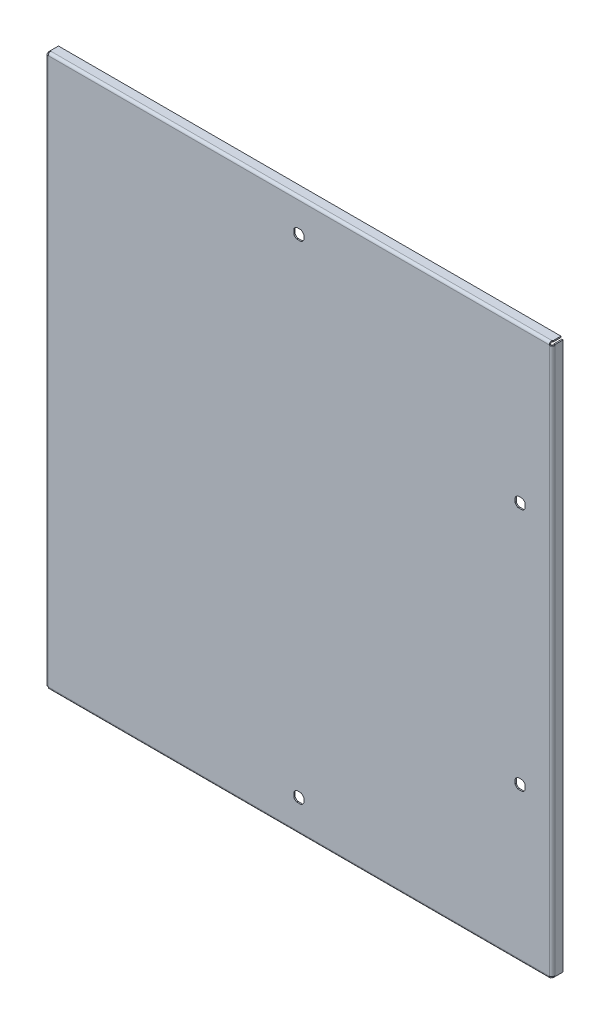
from build123d import *

# Parameters (mm, degrees)
SKETCH1_W               = 1003.3
SKETCH1_H               = 1092.2
SKETCH1_W_2             = 998.22
SKETCH1_H_2             = 1087.12
BOSS_EXTRUDE1_DEPTH     = 21.59
SKETCH3_W               = 1003.3
SKETCH3_H               = 1092.2
BOSS_EXTRUDE2_DEPTH     = 2.54
CUT_EXTRUDE1_REACH      = 865.963
CONVERT_SOLID1_START    = -495.3
CONVERT_SOLID1_DEPTH    = 1003.3
CONVERT_SOLID1_2_DEPTH  = 4.336051224
CONVERT_SOLID1_START_2  = 503.663948776
CONVERT_SOLID1_3_DEPTH  = 4.336051224
CONVERT_SOLID1_START_3  = -490.963948776
CONVERT_SOLID1_4_DEPTH  = 1.378948776
CONVERT_SOLID1_START_4  = 502.285
CONVERT_SOLID1_5_DEPTH  = 1.378948776
CONVERT_SOLID1_START_5  = -489.585
CONVERT_SOLID1_6_DEPTH  = 991.87
CONVERT_SOLID1_START_6  = -391.16
CONVERT_SOLID1_7_DEPTH  = 1087.12
CONVERT_SOLID1_8_DEPTH  = 1.796051224
CONVERT_SOLID1_START_7  = 694.163948776
CONVERT_SOLID1_9_DEPTH  = 1.796051224
CONVERT_SOLID1_START_8  = -389.363948776
CONVERT_SOLID1_10_DEPTH = 1.378948776
CONVERT_SOLID1_START_9  = 692.785
CONVERT_SOLID1_11_DEPTH = 1.378948776
CONVERT_SOLID1_START_10 = -387.985
CONVERT_SOLID1_12_DEPTH = 1080.77


with BuildPart() as part:
    # Sketch1 → Boss-Extrude1 (new body)
    with BuildSketch(Plane.XY):
        with Locations((6.35, 152.4)):
            Rectangle(SKETCH1_W, SKETCH1_H)
        with Locations((6.35, 152.4)):
            Rectangle(SKETCH1_W_2, SKETCH1_H_2, mode=Mode.SUBTRACT)
    extrude(amount=BOSS_EXTRUDE1_DEPTH)

    # Sketch3 → Boss-Extrude2 (add)
    with BuildSketch(Plane.XY.offset(21.59)):
        with Locations((6.35, 152.4)):
            Rectangle(SKETCH3_W, SKETCH3_H)
    extrude(amount=-BOSS_EXTRUDE2_DEPTH)

    # Sketch4 → Cut-Extrude1 (cut, up to next)
    with BuildSketch(Plane.XY.offset(21.59), mode=Mode.PRIVATE) as cut_extrude1_sk1:
        with BuildLine():
            Line((440.173338469, 403.65), (448.826661531, 403.65))
            ThreePointArc((448.826661531, 403.65), (452.172108576, 401.372108576), (454.45, 398.026661531))
            Line((454.45, 398.026661531), (454.45, 389.373338469))
            ThreePointArc((454.45, 389.373338469), (452.172108576, 386.027891424), (448.826661531, 383.75))
            Line((448.826661531, 383.75), (440.173338469, 383.75))
            ThreePointArc((440.173338469, 383.75), (436.827891424, 386.027891424), (434.55, 389.373338469))
            Line((434.55, 389.373338469), (434.55, 398.026661531))
            ThreePointArc((434.55, 398.026661531), (436.827891424, 401.372108576), (440.173338469, 403.65))
        make_face()
    cut_extrude1_tool1 = extrude(cut_extrude1_sk1.sketch, amount=-CUT_EXTRUDE1_REACH, mode=Mode.PRIVATE) & part.part
    # Sketch4 → Cut-Extrude1 (cut, up to next)
    with BuildSketch(Plane.XY.offset(21.59), mode=Mode.PRIVATE) as cut_extrude1_sk2:
        with BuildLine():
            Line((440.173338469, -78.95), (448.826661531, -78.95))
            ThreePointArc((448.826661531, -78.95), (452.172108576, -81.227891424), (454.45, -84.573338469))
            Line((454.45, -84.573338469), (454.45, -93.226661531))
            ThreePointArc((454.45, -93.226661531), (452.172108576, -96.572108576), (448.826661531, -98.85))
            Line((448.826661531, -98.85), (440.173338469, -98.85))
            ThreePointArc((440.173338469, -98.85), (436.827891424, -96.572108576), (434.55, -93.226661531))
            Line((434.55, -93.226661531), (434.55, -84.573338469))
            ThreePointArc((434.55, -84.573338469), (436.827891424, -81.227891424), (440.173338469, -78.95))
        make_face()
    cut_extrude1_tool2 = extrude(cut_extrude1_sk2.sketch, amount=-CUT_EXTRUDE1_REACH, mode=Mode.PRIVATE) & part.part
    # Sketch4 → Cut-Extrude1 (cut, up to next)
    with BuildSketch(Plane.XY.offset(21.59), mode=Mode.PRIVATE) as cut_extrude1_sk3:
        with BuildLine():
            Line((2.023338469, 644.95), (10.676661531, 644.95))
            ThreePointArc((10.676661531, 644.95), (14.022108576, 642.672108576), (16.3, 639.326661531))
            Line((16.3, 639.326661531), (16.3, 630.673338469))
            ThreePointArc((16.3, 630.673338469), (14.022108576, 627.327891424), (10.676661531, 625.05))
            Line((10.676661531, 625.05), (2.023338469, 625.05))
            ThreePointArc((2.023338469, 625.05), (-1.322108576, 627.327891424), (-3.6, 630.673338469))
            Line((-3.6, 630.673338469), (-3.6, 639.326661531))
            ThreePointArc((-3.6, 639.326661531), (-1.322108576, 642.672108576), (2.023338469, 644.95))
        make_face()
    cut_extrude1_tool3 = extrude(cut_extrude1_sk3.sketch, amount=-CUT_EXTRUDE1_REACH, mode=Mode.PRIVATE) & part.part
    # Sketch4 → Cut-Extrude1 (cut, up to next)
    with BuildSketch(Plane.XY.offset(21.59), mode=Mode.PRIVATE) as cut_extrude1_sk4:
        with BuildLine():
            Line((2.023338469, -320.25), (10.676661531, -320.25))
            ThreePointArc((10.676661531, -320.25), (14.022108576, -322.527891424), (16.3, -325.873338469))
            Line((16.3, -325.873338469), (16.3, -334.526661531))
            ThreePointArc((16.3, -334.526661531), (14.022108576, -337.872108576), (10.676661531, -340.15))
            Line((10.676661531, -340.15), (2.023338469, -340.15))
            ThreePointArc((2.023338469, -340.15), (-1.322108576, -337.872108576), (-3.6, -334.526661531))
            Line((-3.6, -334.526661531), (-3.6, -325.873338469))
            ThreePointArc((-3.6, -325.873338469), (-1.322108576, -322.527891424), (2.023338469, -320.25))
        make_face()
    cut_extrude1_tool4 = extrude(cut_extrude1_sk4.sketch, amount=-CUT_EXTRUDE1_REACH, mode=Mode.PRIVATE) & part.part
    add(cut_extrude1_tool1.solids().sort_by_distance((444.5, 393.7, 21.59))[0], mode=Mode.SUBTRACT)
    add(cut_extrude1_tool2.solids().sort_by_distance((444.5, -88.9, 21.59))[0], mode=Mode.SUBTRACT)
    add(cut_extrude1_tool3.solids().sort_by_distance((6.35, 635, 21.59))[0], mode=Mode.SUBTRACT)
    add(cut_extrude1_tool4.solids().sort_by_distance((6.35, -330.2, 21.59))[0], mode=Mode.SUBTRACT)

    # Convert-Solid1: read off the stored shape, not the designer's step
    # Convert-Solid1 outline → Convert-Solid1 (cut)
    with BuildSketch(Plane.YZ.offset(CONVERT_SOLID1_START)):
        with BuildLine():
            ThreePointArc((-393.7, 16.51), (-392.212102448, 20.102102448), (-388.62, 21.59))
            Line((-388.62, 21.59), (-393.7, 21.59))
            Line((-393.7, 21.59), (-393.7, 16.51))
        make_face()
        with BuildLine():
            Line((698.5, 21.59), (693.42, 21.59))
            ThreePointArc((693.42, 21.59), (697.012102448, 20.102102448), (698.5, 16.51))
            Line((698.5, 16.51), (698.5, 21.59))
        make_face()
    extrude(amount=CONVERT_SOLID1_DEPTH, mode=Mode.SUBTRACT)

    # Convert-Solid1 2 outline → Convert-Solid1 2 (cut)
    with BuildSketch(Plane.YZ.offset(CONVERT_SOLID1_START)):
        with BuildLine():
            Line((-388.62, 19.05), (-387.985, 19.05))
            Line((-387.985, 19.05), (-387.985, 21.59))
            Line((-387.985, 21.59), (-388.62, 21.59))
            ThreePointArc((-388.62, 21.59), (-392.212102448, 20.102102448), (-393.7, 16.51))
            Line((-393.7, 16.51), (-393.7, 0))
            Line((-393.7, 0), (-391.16, 0))
            Line((-391.16, 0), (-391.16, 16.51))
            ThreePointArc((-391.16, 16.51), (-390.416051224, 18.306051224), (-388.62, 19.05))
        make_face()
        with BuildLine():
            Line((692.785, 21.59), (692.785, 19.05))
            Line((692.785, 19.05), (693.42, 19.05))
            ThreePointArc((693.42, 19.05), (695.216051224, 18.306051224), (695.96, 16.51))
            Line((695.96, 16.51), (695.96, 0))
            Line((695.96, 0), (698.5, 0))
            Line((698.5, 0), (698.5, 16.51))
            ThreePointArc((698.5, 16.51), (697.012102448, 20.102102448), (693.42, 21.59))
            Line((693.42, 21.59), (692.785, 21.59))
        make_face()
    extrude(amount=CONVERT_SOLID1_2_DEPTH, mode=Mode.SUBTRACT)

    # Convert-Solid1 3 outline → Convert-Solid1 3 (cut)
    with BuildSketch(Plane.YZ.offset(CONVERT_SOLID1_START_2)):
        with BuildLine():
            Line((-388.62, 19.05), (-387.985, 19.05))
            Line((-387.985, 19.05), (-387.985, 21.59))
            Line((-387.985, 21.59), (-388.62, 21.59))
            ThreePointArc((-388.62, 21.59), (-392.212102448, 20.102102448), (-393.7, 16.51))
            Line((-393.7, 16.51), (-393.7, 0))
            Line((-393.7, 0), (-391.16, 0))
            Line((-391.16, 0), (-391.16, 16.51))
            ThreePointArc((-391.16, 16.51), (-390.416051224, 18.306051224), (-388.62, 19.05))
        make_face()
        with BuildLine():
            Line((692.785, 21.59), (692.785, 19.05))
            Line((692.785, 19.05), (693.42, 19.05))
            ThreePointArc((693.42, 19.05), (695.216051224, 18.306051224), (695.96, 16.51))
            Line((695.96, 16.51), (695.96, 0))
            Line((695.96, 0), (698.5, 0))
            Line((698.5, 0), (698.5, 16.51))
            ThreePointArc((698.5, 16.51), (697.012102448, 20.102102448), (693.42, 21.59))
            Line((693.42, 21.59), (692.785, 21.59))
        make_face()
    extrude(amount=CONVERT_SOLID1_3_DEPTH, mode=Mode.SUBTRACT)

    # Convert-Solid1 4 outline → Convert-Solid1 4 (cut)
    with BuildSketch(Plane.YZ.offset(CONVERT_SOLID1_START_3)):
        with BuildLine():
            Line((-391.16, 19.05), (-387.985, 19.05))
            Line((-387.985, 19.05), (-387.985, 21.59))
            Line((-387.985, 21.59), (-388.62, 21.59))
            ThreePointArc((-388.62, 21.59), (-392.212102448, 20.102102448), (-393.7, 16.51))
            Line((-393.7, 16.51), (-393.7, 15.875))
            Line((-393.7, 15.875), (-391.16, 15.875))
            Line((-391.16, 15.875), (-391.16, 19.05))
        make_face()
        with BuildLine():
            Line((692.785, 21.59), (692.785, 19.05))
            Line((692.785, 19.05), (695.96, 19.05))
            Line((695.96, 19.05), (695.96, 15.875))
            Line((695.96, 15.875), (698.5, 15.875))
            Line((698.5, 15.875), (698.5, 16.51))
            ThreePointArc((698.5, 16.51), (697.012102448, 20.102102448), (693.42, 21.59))
            Line((693.42, 21.59), (692.785, 21.59))
        make_face()
    extrude(amount=CONVERT_SOLID1_4_DEPTH, mode=Mode.SUBTRACT)

    # Convert-Solid1 5 outline → Convert-Solid1 5 (cut)
    with BuildSketch(Plane.YZ.offset(CONVERT_SOLID1_START_4)):
        with BuildLine():
            Line((-391.16, 19.05), (-387.985, 19.05))
            Line((-387.985, 19.05), (-387.985, 21.59))
            Line((-387.985, 21.59), (-388.62, 21.59))
            ThreePointArc((-388.62, 21.59), (-392.212102448, 20.102102448), (-393.7, 16.51))
            Line((-393.7, 16.51), (-393.7, 15.875))
            Line((-393.7, 15.875), (-391.16, 15.875))
            Line((-391.16, 15.875), (-391.16, 19.05))
        make_face()
        with BuildLine():
            Line((692.785, 21.59), (692.785, 19.05))
            Line((692.785, 19.05), (695.96, 19.05))
            Line((695.96, 19.05), (695.96, 15.875))
            Line((695.96, 15.875), (698.5, 15.875))
            Line((698.5, 15.875), (698.5, 16.51))
            ThreePointArc((698.5, 16.51), (697.012102448, 20.102102448), (693.42, 21.59))
            Line((693.42, 21.59), (692.785, 21.59))
        make_face()
    extrude(amount=CONVERT_SOLID1_5_DEPTH, mode=Mode.SUBTRACT)

    # Convert-Solid1 6 outline → Convert-Solid1 6 (add)
    with BuildSketch(Plane.YZ.offset(CONVERT_SOLID1_START_5)):
        with BuildLine():
            ThreePointArc((-391.16, 16.51), (-390.416051224, 18.306051224), (-388.62, 19.05))
            Line((-388.62, 19.05), (-391.16, 19.05))
            Line((-391.16, 19.05), (-391.16, 16.51))
        make_face()
        with BuildLine():
            Line((695.96, 19.05), (693.42, 19.05))
            ThreePointArc((693.42, 19.05), (695.216051224, 18.306051224), (695.96, 16.51))
            Line((695.96, 16.51), (695.96, 19.05))
        make_face()
    extrude(amount=CONVERT_SOLID1_6_DEPTH)

    # Convert-Solid1 7 outline → Convert-Solid1 7 (cut)
    with BuildSketch(Plane(origin=(0, 0, 0), x_dir=(1, 0, 0), z_dir=(0, 1, 0)).offset(CONVERT_SOLID1_START_6)):
        with BuildLine():
            ThreePointArc((508, -16.51), (506.512102448, -20.102102448), (502.92, -21.59))
            Line((502.92, -21.59), (508, -21.59))
            Line((508, -21.59), (508, -16.51))
        make_face()
        with BuildLine():
            Line((-495.3, -21.59), (-490.22, -21.59))
            ThreePointArc((-490.22, -21.59), (-493.812102448, -20.102102448), (-495.3, -16.51))
            Line((-495.3, -16.51), (-495.3, -21.59))
        make_face()
    extrude(amount=CONVERT_SOLID1_7_DEPTH, mode=Mode.SUBTRACT)

    # Convert-Solid1 8 outline → Convert-Solid1 8 (cut)
    with BuildSketch(Plane(origin=(0, 0, 0), x_dir=(1, 0, 0), z_dir=(0, 1, 0)).offset(CONVERT_SOLID1_START_6)):
        with BuildLine():
            Line((508, -16.51), (508, 0))
            Line((508, 0), (505.46, 0))
            Line((505.46, 0), (505.46, -19.05))
            Line((505.46, -19.05), (507.319409051, -19.05))
            ThreePointArc((507.319409051, -19.05), (507.826903197, -17.824800749), (508, -16.51))
        make_face()
        with BuildLine():
            Line((-492.76, -19.05), (-492.76, 0))
            Line((-492.76, 0), (-495.3, 0))
            Line((-495.3, 0), (-495.3, -16.51))
            ThreePointArc((-495.3, -16.51), (-495.126903197, -17.824800749), (-494.619409051, -19.05))
            Line((-494.619409051, -19.05), (-492.76, -19.05))
        make_face()
    extrude(amount=CONVERT_SOLID1_8_DEPTH, mode=Mode.SUBTRACT)

    # Convert-Solid1 9 outline → Convert-Solid1 9 (cut)
    with BuildSketch(Plane(origin=(0, 0, 0), x_dir=(1, 0, 0), z_dir=(0, 1, 0)).offset(CONVERT_SOLID1_START_7)):
        with BuildLine():
            Line((508, -16.51), (508, 0))
            Line((508, 0), (505.46, 0))
            Line((505.46, 0), (505.46, -19.05))
            Line((505.46, -19.05), (507.319409051, -19.05))
            ThreePointArc((507.319409051, -19.05), (507.826903197, -17.824800749), (508, -16.51))
        make_face()
        with BuildLine():
            Line((-492.76, -19.05), (-492.76, 0))
            Line((-492.76, 0), (-495.3, 0))
            Line((-495.3, 0), (-495.3, -16.51))
            ThreePointArc((-495.3, -16.51), (-495.126903197, -17.824800749), (-494.619409051, -19.05))
            Line((-494.619409051, -19.05), (-492.76, -19.05))
        make_face()
    extrude(amount=CONVERT_SOLID1_9_DEPTH, mode=Mode.SUBTRACT)

    # Convert-Solid1 10 outline → Convert-Solid1 10 (cut)
    with BuildSketch(Plane(origin=(0, 0, 0), x_dir=(1, 0, 0), z_dir=(0, 1, 0)).offset(CONVERT_SOLID1_START_8)):
        with BuildLine():
            Line((508, -16.51), (508, -15.875))
            Line((508, -15.875), (505.46, -15.875))
            Line((505.46, -15.875), (505.46, -19.05))
            Line((505.46, -19.05), (507.319409051, -19.05))
            ThreePointArc((507.319409051, -19.05), (507.826903197, -17.824800749), (508, -16.51))
        make_face()
        with BuildLine():
            Line((-492.76, -19.05), (-492.76, -15.875))
            Line((-492.76, -15.875), (-495.3, -15.875))
            Line((-495.3, -15.875), (-495.3, -16.51))
            ThreePointArc((-495.3, -16.51), (-495.126903197, -17.824800749), (-494.619409051, -19.05))
            Line((-494.619409051, -19.05), (-492.76, -19.05))
        make_face()
    extrude(amount=CONVERT_SOLID1_10_DEPTH, mode=Mode.SUBTRACT)

    # Convert-Solid1 11 outline → Convert-Solid1 11 (cut)
    with BuildSketch(Plane(origin=(0, 0, 0), x_dir=(1, 0, 0), z_dir=(0, 1, 0)).offset(CONVERT_SOLID1_START_9)):
        with BuildLine():
            Line((508, -16.51), (508, -15.875))
            Line((508, -15.875), (505.46, -15.875))
            Line((505.46, -15.875), (505.46, -19.05))
            Line((505.46, -19.05), (507.319409051, -19.05))
            ThreePointArc((507.319409051, -19.05), (507.826903197, -17.824800749), (508, -16.51))
        make_face()
        with BuildLine():
            Line((-492.76, -19.05), (-492.76, -15.875))
            Line((-492.76, -15.875), (-495.3, -15.875))
            Line((-495.3, -15.875), (-495.3, -16.51))
            ThreePointArc((-495.3, -16.51), (-495.126903197, -17.824800749), (-494.619409051, -19.05))
            Line((-494.619409051, -19.05), (-492.76, -19.05))
        make_face()
    extrude(amount=CONVERT_SOLID1_11_DEPTH, mode=Mode.SUBTRACT)

    # Convert-Solid1 12 outline → Convert-Solid1 12 (add)
    with BuildSketch(Plane(origin=(0, 0, 0), x_dir=(1, 0, 0), z_dir=(0, 1, 0)).offset(CONVERT_SOLID1_START_10)):
        with BuildLine():
            Line((505.46, -19.05), (505.46, -16.51))
            ThreePointArc((505.46, -16.51), (504.716051224, -18.306051224), (502.92, -19.05))
            Line((502.92, -19.05), (505.46, -19.05))
        make_face()
        with BuildLine():
            Line((-492.76, -19.05), (-490.22, -19.05))
            ThreePointArc((-490.22, -19.05), (-492.016051224, -18.306051224), (-492.76, -16.51))
            Line((-492.76, -16.51), (-492.76, -19.05))
        make_face()
    extrude(amount=CONVERT_SOLID1_12_DEPTH)


solid = part.part
